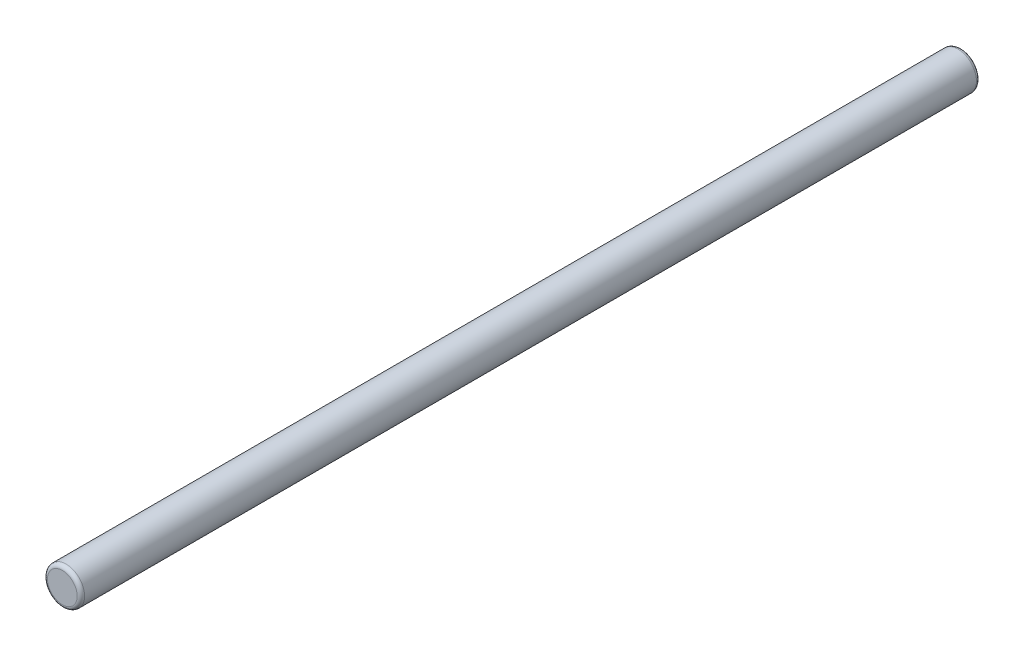
from build123d import *

# Parameters (mm, degrees)
ESBO_O1_R                = 2.35
RESSALTO_EXTRUS_O3_DEPTH = 113.94
FILETE1_R                = 0.47


with BuildPart() as part:
    # Esboço1 → Ressalto-extrusão3 (new body)
    with BuildSketch(Plane.XY):
        Circle(ESBO_O1_R)
    extrude(amount=RESSALTO_EXTRUS_O3_DEPTH)

    # Filete1
    filete1_edges = [part.edges().sort_by_distance(p)[0] for p in [
        (-2.35, 0, 0),
        (-2.35, 0, 113.94),
    ]]
    fillet(filete1_edges, radius=FILETE1_R)


solid = part.part
